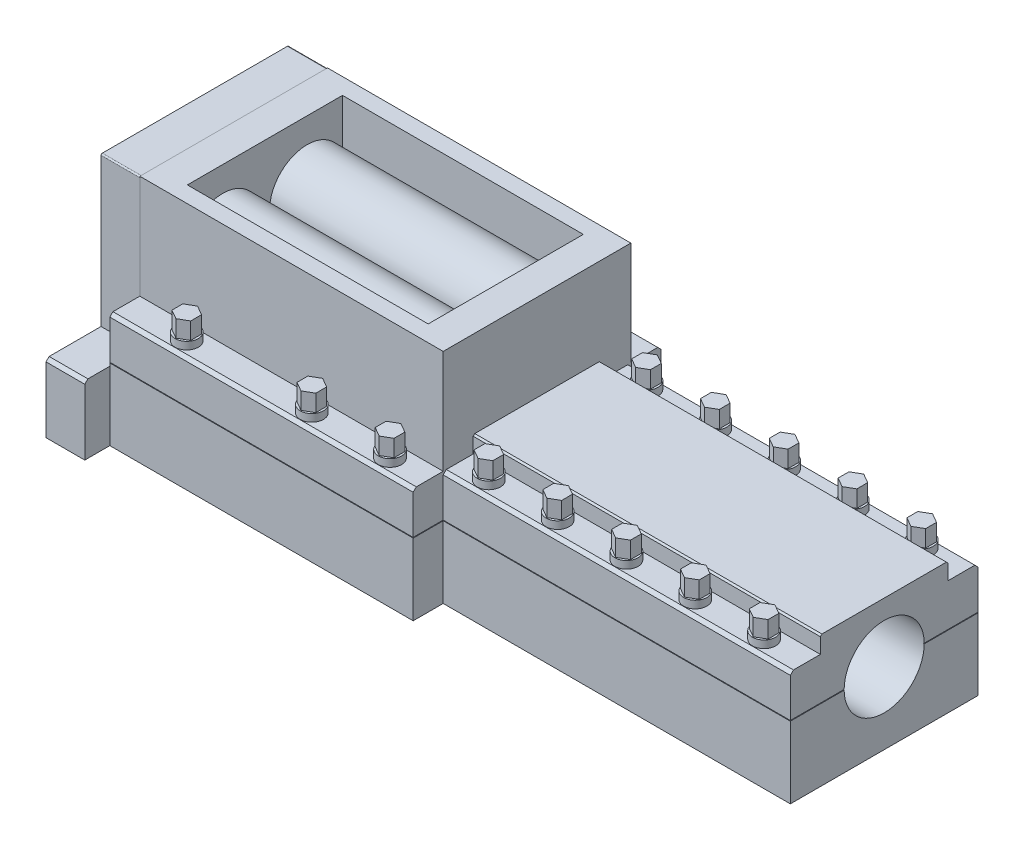
from build123d import *

# Parameters (mm, degrees)
AUFSATZ_LINEAR_AUSTRAGEN1_DEPTH  = 198
SKIZZE2_W                        = 555
SKIZZE2_H                        = 48
SCHNITT_LINEAR_AUSTRAGEN1_DEPTH  = 595.730190927
SKIZZE3_W                        = 555
SKIZZE3_H                        = 48
SCHNITT_LINEAR_AUSTRAGEN2_DEPTH  = 27
SKIZZE4_W                        = 485
SKIZZE4_H                        = 48
SCHNITT_LINEAR_AUSTRAGEN3_DEPTH  = 166
SKIZZE6_R                        = 64
SCHNITT_LINEAR_AUSTRAGEN4_DEPTH  = 1115.721938422
SKIZZE7_W                        = 385
SKIZZE7_H                        = 248
SCHNITT_LINEAR_AUSTRAGEN5_DEPTH  = 218
AUFSATZ_LINEAR_AUSTRAGEN2_REACH  = 1070.225
SKIZZE8_R                        = 60
SKIZZE10_W                       = 300
SKIZZE10_H                       = 1
SCHNITT_LINEAR_AUSTRAGEN6_DEPTH  = 1
SKIZZE11_W                       = 555
SKIZZE11_H                       = 1
SCHNITT_LINEAR_AUSTRAGEN7_DEPTH  = 1
SKIZZE12_W                       = 555
SKIZZE12_H                       = 1
SCHNITT_LINEAR_AUSTRAGEN8_DEPTH  = 1
SKIZZE13_W                       = 49
SKIZZE13_H                       = 1
SCHNITT_LINEAR_AUSTRAGEN9_DEPTH  = 1
SKIZZE14_W                       = 485
SKIZZE14_H                       = 1
SCHNITT_LINEAR_AUSTRAGEN10_DEPTH = 1
SKIZZE15_W                       = 485
SKIZZE15_H                       = 1
SCHNITT_LINEAR_AUSTRAGEN11_DEPTH = 1
SKIZZE17_W                       = 394
SKIZZE17_H                       = 1
SCHNITT_LINEAR_AUSTRAGEN12_DEPTH = 1
FASE1_SIZE                       = 5
FASE2_SIZE                       = 2.5
AUFSATZ_LINEAR_AUSTRAGEN5_DEPTH  = 62
SKIZZE19_R                       = 18.5
AUFSATZ_LINEAR_AUSTRAGEN6_DEPTH  = 12
AUFSATZ_LINEAR_AUSTRAGEN7_DEPTH  = 27
AUFSATZ_LINEAR_AUSTRAGEN8_DEPTH  = 62
SKIZZE9_W                        = 110
SKIZZE9_H                        = 41
AUFSATZ_LINEAR_AUSTRAGEN10_DEPTH = 48


with BuildPart() as part:
    # Skizze1 → Aufsatz-Linear austragen1 (new, symmetric)
    with BuildSketch(Plane.XY):
        Polygon((-520, 0), (520, 0), (520, 210), (-35, 210), (-35, 349), (-520, 349), align=None)
    extrude(amount=AUFSATZ_LINEAR_AUSTRAGEN1_DEPTH, both=True)

    # Skizze2 → Schnitt-Linear austragen1 (cut, through all)
    with BuildSketch(Plane(origin=(0, 210, 0), x_dir=(1, 0, 0), z_dir=(0, 1, 0))):
        with Locations((242.5, 174)):
            Rectangle(SKIZZE2_W, SKIZZE2_H)
        with Locations((242.5, -174)):
            Rectangle(SKIZZE2_W, SKIZZE2_H)
    extrude(amount=-SCHNITT_LINEAR_AUSTRAGEN1_DEPTH, mode=Mode.SUBTRACT)

    # Skizze3 → Schnitt-Linear austragen2 (cut)
    with BuildSketch(Plane(origin=(0, 210, 0), x_dir=(1, 0, 0), z_dir=(0, 1, 0))):
        with Locations((242.5, 126)):
            Rectangle(SKIZZE3_W, SKIZZE3_H)
        with Locations((242.5, -126)):
            Rectangle(SKIZZE3_W, SKIZZE3_H)
    extrude(amount=-SCHNITT_LINEAR_AUSTRAGEN2_DEPTH, mode=Mode.SUBTRACT)

    # Skizze4 → Schnitt-Linear austragen3 (cut)
    with BuildSketch(Plane(origin=(0, 349, 0), x_dir=(1, 0, 0), z_dir=(0, 1, 0))):
        with Locations((-277.5, 174)):
            Rectangle(SKIZZE4_W, SKIZZE4_H)
        with Locations((-277.5, -174)):
            Rectangle(SKIZZE4_W, SKIZZE4_H)
    extrude(amount=-SCHNITT_LINEAR_AUSTRAGEN3_DEPTH, mode=Mode.SUBTRACT)

    # Skizze6 → Schnitt-Linear austragen4 (cut, through all)
    with BuildSketch(Plane(origin=(520, 0, 0), x_dir=(0, 0, -1), z_dir=(1, 0, 0))):
        with Locations((0, 115)):
            Circle(SKIZZE6_R)
    extrude(amount=-SCHNITT_LINEAR_AUSTRAGEN4_DEPTH, mode=Mode.SUBTRACT)

    # Skizze7 → Schnitt-Linear austragen5 (cut)
    with BuildSketch(Plane(origin=(0, 349, 0), x_dir=(1, 0, 0), z_dir=(0, 1, 0))):
        with Locations((-277.5, 0)):
            Rectangle(SKIZZE7_W, SKIZZE7_H)
    extrude(amount=-SCHNITT_LINEAR_AUSTRAGEN5_DEPTH, mode=Mode.SUBTRACT)

    # Skizze8 → Aufsatz-Linear austragen2 (add, up to next)
    with BuildSketch(Plane(origin=(-470, 0, 0), x_dir=(0, 0, -1), z_dir=(1, 0, 0)), mode=Mode.PRIVATE) as aufsatz_linear_austragen2_sk1:
        with Locations((-67.5, 249)):
            Circle(SKIZZE8_R)
    aufsatz_linear_austragen2_tool1 = extrude(aufsatz_linear_austragen2_sk1.sketch, amount=AUFSATZ_LINEAR_AUSTRAGEN2_REACH, mode=Mode.PRIVATE) - part.part
    # Skizze8 → Aufsatz-Linear austragen2 (add, up to next)
    with BuildSketch(Plane(origin=(-470, 0, 0), x_dir=(0, 0, -1), z_dir=(1, 0, 0)), mode=Mode.PRIVATE) as aufsatz_linear_austragen2_sk2:
        with Locations((67.5, 249)):
            Circle(SKIZZE8_R)
    aufsatz_linear_austragen2_tool2 = extrude(aufsatz_linear_austragen2_sk2.sketch, amount=AUFSATZ_LINEAR_AUSTRAGEN2_REACH, mode=Mode.PRIVATE) - part.part
    add(aufsatz_linear_austragen2_tool1.solids().sort_by_distance((-470, 249, 67.5))[0])
    add(aufsatz_linear_austragen2_tool2.solids().sort_by_distance((-470, 249, -67.5))[0])

    # Skizze10 → Schnitt-Linear austragen6 (cut)
    with BuildSketch(Plane(origin=(520, 0, 0), x_dir=(0, 0, -1), z_dir=(1, 0, 0))):
        with Locations((0, 115)):
            Rectangle(SKIZZE10_W, SKIZZE10_H)
    extrude(amount=-SCHNITT_LINEAR_AUSTRAGEN6_DEPTH, mode=Mode.SUBTRACT)

    # Skizze11 → Schnitt-Linear austragen7 (cut)
    with BuildSketch(Plane(origin=(0, 0, -150), x_dir=(-1, 0, 0), z_dir=(0, 0, -1))):
        with Locations((-242.5, 115)):
            Rectangle(SKIZZE11_W, SKIZZE11_H)
    extrude(amount=-SCHNITT_LINEAR_AUSTRAGEN7_DEPTH, mode=Mode.SUBTRACT)

    # Skizze12 → Schnitt-Linear austragen8 (cut)
    with BuildSketch(Plane.XY.offset(150)):
        with Locations((242.5, 115)):
            Rectangle(SKIZZE12_W, SKIZZE12_H)
    extrude(amount=-SCHNITT_LINEAR_AUSTRAGEN8_DEPTH, mode=Mode.SUBTRACT)

    # Skizze13 → Schnitt-Linear austragen9 (cut)
    with BuildSketch(Plane(origin=(-35, 0, 0), x_dir=(0, 0, -1), z_dir=(1, 0, 0))):
        with Locations((-173.5, 115)):
            Rectangle(SKIZZE13_W, SKIZZE13_H)
        with Locations((173.5, 115)):
            Rectangle(SKIZZE13_W, SKIZZE13_H)
    extrude(amount=-SCHNITT_LINEAR_AUSTRAGEN9_DEPTH, mode=Mode.SUBTRACT)

    # Skizze14 → Schnitt-Linear austragen10 (cut)
    with BuildSketch(Plane.XY.offset(198)):
        with Locations((-277.5, 115)):
            Rectangle(SKIZZE14_W, SKIZZE14_H)
    extrude(amount=-SCHNITT_LINEAR_AUSTRAGEN10_DEPTH, mode=Mode.SUBTRACT)

    # Skizze15 → Schnitt-Linear austragen11 (cut)
    with BuildSketch(Plane(origin=(0, 0, -198), x_dir=(-1, 0, 0), z_dir=(0, 0, -1))):
        with Locations((277.5, 115)):
            Rectangle(SKIZZE15_W, SKIZZE15_H)
    extrude(amount=-SCHNITT_LINEAR_AUSTRAGEN11_DEPTH, mode=Mode.SUBTRACT)

    # Skizze17 → Schnitt-Linear austragen12 (cut)
    with BuildSketch(Plane.ZY.offset(520)):
        with Locations((0, 115)):
            Rectangle(SKIZZE17_W, SKIZZE17_H)
    extrude(amount=-SCHNITT_LINEAR_AUSTRAGEN12_DEPTH, mode=Mode.SUBTRACT)

    # Fase1
    # the kernel refuses this chamfer: 5 mm, written as the material it takes off along each edge
    with BuildSketch(Plane(origin=(-35, 183, -150), x_dir=(0, 0.027495876610587663, 0.9996219169112968), z_dir=(1, 0, 0))) as fase1_piece_1:
        Polygon((FASE1_SIZE * 0.999621916911, FASE1_SIZE * 0.0274958766106), (-FASE1_SIZE * 0.0274958766106, FASE1_SIZE * 0.999621916911), (0, 0), align=None)
    extrude(amount=567.85841494, mode=Mode.SUBTRACT)
    with BuildSketch(Plane(origin=(532.85841494, 183, 150), x_dir=(0, -0.9996219169112968, 0.027495876610587663), z_dir=(-1, 0, 0))) as fase1_piece_2:
        Polygon((FASE1_SIZE * 0.999621916911, -FASE1_SIZE * 0.0274958766106), (-FASE1_SIZE * 0.0274958766106, -FASE1_SIZE * 0.999621916911), (0, 0), align=None)
    extrude(amount=567.85841494, mode=Mode.SUBTRACT)
    with BuildSketch(Plane(origin=(-532.85841494, 183, -198), x_dir=(0, 0.027495876610587663, 0.9996219169112968), z_dir=(1, 0, 0))) as fase1_piece_3:
        Polygon((FASE1_SIZE * 0.999621916911, FASE1_SIZE * 0.0274958766106), (-FASE1_SIZE * 0.0274958766106, FASE1_SIZE * 0.999621916911), (0, 0), align=None)
    extrude(amount=510.71682988, mode=Mode.SUBTRACT)
    with BuildSketch(Plane(origin=(-22.14158506, 183, 198), x_dir=(0, -0.9996219169112968, 0.027495876610587663), z_dir=(-1, 0, 0))) as fase1_piece_4:
        Polygon((FASE1_SIZE * 0.999621916911, -FASE1_SIZE * 0.0274958766106), (-FASE1_SIZE * 0.0274958766106, -FASE1_SIZE * 0.999621916911), (0, 0), align=None)
    extrude(amount=510.71682988, mode=Mode.SUBTRACT)

    # Fase2
    fase2_edges = [part.edges().sort_by_distance(p)[0] for p in [
        (242.5, 210, -102),
        (242.5, 210, 102),
    ]]
    chamfer(fase2_edges, length=FASE2_SIZE)

    # Skizze18 → Aufsatz-Linear austragen5 (add)
    with BuildSketch(Plane.ZY.offset(520)):
        Polygon((-128, 0), (-238, 0), (-238, 105), (-233, 110), (-133, 110), (-128, 105), align=None)
        Polygon((128, 0), (238, 0), (238, 105), (233, 110), (133, 110), (128, 105), align=None)
    extrude(amount=AUFSATZ_LINEAR_AUSTRAGEN5_DEPTH)

    # Skizze19 → Aufsatz-Linear austragen6 (add)
    with BuildSketch(Plane(origin=(0, 183, 0), x_dir=(1, 0, 0), z_dir=(0, 1, 0))):
        with Locations((454, 126)):
            Circle(SKIZZE19_R)
        with Locations((344, 126)):
            Circle(SKIZZE19_R)
        with Locations((234, 126)):
            Circle(SKIZZE19_R)
        with Locations(Location((-421, -174, 0), (0, 0, 180))):
            Circle(SKIZZE19_R)
        with Locations(Location((-221, -174, 0), (0, 0, 180))):
            Circle(SKIZZE19_R)
        with Locations(Location((-96, -174, 0), (0, 0, 180))):
            Circle(SKIZZE19_R)
        with Locations(Location((14, -126, 0), (0, 0, 180))):
            Circle(SKIZZE19_R)
        with Locations(Location((124, -126, 0), (0, 0, 180))):
            Circle(SKIZZE19_R)
        with Locations(Location((234, -126, 0), (0, 0, 180))):
            Circle(SKIZZE19_R)
        with Locations(Location((344, -126, 0), (0, 0, 180))):
            Circle(SKIZZE19_R)
        with Locations(Location((454, -126, 0), (0, 0, 180))):
            Circle(SKIZZE19_R)
        with Locations((124, 126)):
            Circle(SKIZZE19_R)
        with Locations((14, 126)):
            Circle(SKIZZE19_R)
        with Locations((-96, 174)):
            Circle(SKIZZE19_R)
        with Locations((-221, 174)):
            Circle(SKIZZE19_R)
        with Locations((-421, 174)):
            Circle(SKIZZE19_R)
    extrude(amount=AUFSATZ_LINEAR_AUSTRAGEN6_DEPTH)

    # Skizze20 → Aufsatz-Linear austragen7 (add)
    with BuildSketch(Plane(origin=(0, 195, 0), x_dir=(1, 0, 0), z_dir=(0, 1, 0))):
        Polygon((-406, -165.339745962), (-421, -156.679491924), (-436, -165.339745962), (-436, -182.660254038), (-421, -191.320508076), (-406, -182.660254038), align=None)
        Polygon((-206, -165.339745962), (-221, -156.679491924), (-236, -165.339745962), (-236, -182.660254038), (-221, -191.320508076), (-206, -182.660254038), align=None)
        Polygon((-81, -165.339745962), (-96, -156.679491924), (-111, -165.339745962), (-111, -182.660254038), (-96, -191.320508076), (-81, -182.660254038), align=None)
        Polygon((29, -117.339745962), (14, -108.679491924), (-1, -117.339745962), (-1, -134.660254038), (14, -143.320508076), (29, -134.660254038), align=None)
        Polygon((139, -117.339745962), (124, -108.679491924), (109, -117.339745962), (109, -134.660254038), (124, -143.320508076), (139, -134.660254038), align=None)
        Polygon((249, -117.339745962), (234, -108.679491924), (219, -117.339745962), (219, -134.660254038), (234, -143.320508076), (249, -134.660254038), align=None)
        Polygon((359, -117.339745962), (344, -108.679491924), (329, -117.339745962), (329, -134.660254038), (344, -143.320508076), (359, -134.660254038), align=None)
        Polygon((469, -117.339745962), (454, -108.679491924), (439, -117.339745962), (439, -134.660254038), (454, -143.320508076), (469, -134.660254038), align=None)
        Polygon((469, 134.660254038), (469, 117.339745962), (454, 108.679491924), (439, 117.339745962), (439, 134.660254038), (454, 143.320508076), align=None)
        Polygon((359, 134.660254038), (359, 117.339745962), (344, 108.679491924), (329, 117.339745962), (329, 134.660254038), (344, 143.320508076), align=None)
        Polygon((249, 134.660254038), (249, 117.339745962), (234, 108.679491924), (219, 117.339745962), (219, 134.660254038), (234, 143.320508076), align=None)
        Polygon((139, 134.660254038), (139, 117.339745962), (124, 108.679491924), (109, 117.339745962), (109, 134.660254038), (124, 143.320508076), align=None)
        Polygon((29, 134.660254038), (29, 117.339745962), (14, 108.679491924), (-1, 117.339745962), (-1, 134.660254038), (14, 143.320508076), align=None)
        Polygon((-81, 182.660254038), (-81, 165.339745962), (-96, 156.679491924), (-111, 165.339745962), (-111, 182.660254038), (-96, 191.320508076), align=None)
        Polygon((-206, 182.660254038), (-206, 165.339745962), (-221, 156.679491924), (-236, 165.339745962), (-236, 182.660254038), (-221, 191.320508076), align=None)
        Polygon((-406, 182.660254038), (-406, 165.339745962), (-421, 156.679491924), (-436, 165.339745962), (-436, 182.660254038), (-421, 191.320508076), align=None)
    extrude(amount=AUFSATZ_LINEAR_AUSTRAGEN7_DEPTH)

    # Skizze9 → Aufsatz-Linear austragen10 (add)
    with BuildSketch(Plane(origin=(0, 0, -150), x_dir=(-1, 0, 0), z_dir=(0, 0, -1))):
        with Locations((320, 198.5)):
            Rectangle(SKIZZE9_W, SKIZZE9_H)
    extrude(amount=AUFSATZ_LINEAR_AUSTRAGEN10_DEPTH)


with BuildPart() as body_2:
    # Skizze21 → Aufsatz-Linear austragen8 (new body)
    with BuildSketch(Plane.ZY.offset(520)):
        with BuildLine():
            Line((-150, 346.9), (-150, 110))
            Line((-150, 110), (-148, 110))
            Line((-148, 110), (-148, 346.9))
            ThreePointArc((-148, 346.9), (-147.970710678, 346.970710678), (-147.9, 347))
            Line((-147.9, 347), (147.9, 347))
            ThreePointArc((147.9, 347), (147.970710678, 346.970710678), (148, 346.9))
            Line((148, 346.9), (148, 110))
            Line((148, 110), (150, 110))
            Line((150, 110), (150, 346.9))
            ThreePointArc((150, 346.9), (149.38492424, 348.38492424), (147.9, 349))
            Line((147.9, 349), (-147.9, 349))
            ThreePointArc((-147.9, 349), (-149.38492424, 348.38492424), (-150, 346.9))
        make_face()
    extrude(amount=AUFSATZ_LINEAR_AUSTRAGEN8_DEPTH)


solid = Compound([part.part, body_2.part])
